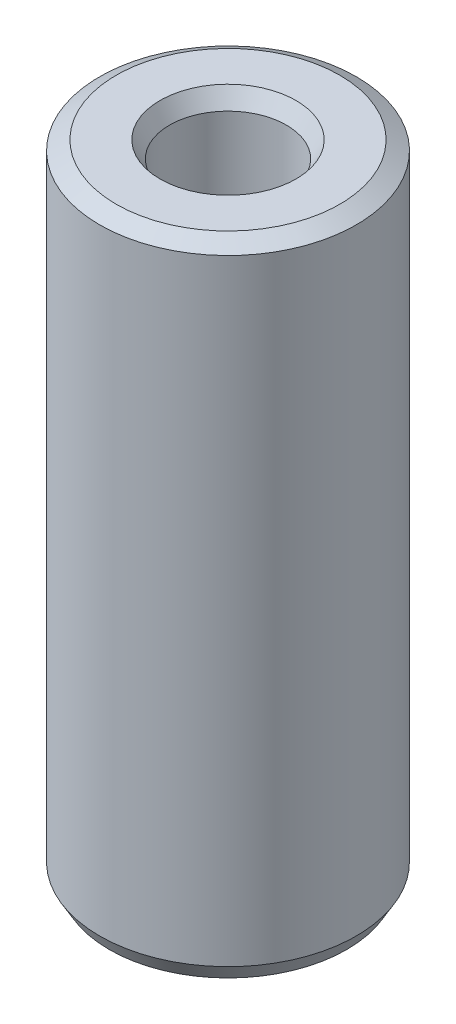
from build123d import *
from OCP.BRepFilletAPI import BRepFilletAPI_MakeChamfer

# Parameters (mm, degrees)
SKETCH1_R           = 30
BOSS_EXTRUDE1_DEPTH = 150.065307436
SKETCH2_R           = 13.669233363
CUT_EXTRUDE1_DEPTH  = 156.947415804
CHAMFER1_SIZE       = 2.232275058
CHAMFER1_SIZE2      = 3.866413817


with BuildPart() as part:
    # Sketch1 → Boss-Extrude1 (new body)
    with BuildSketch(Plane(origin=(0, 0, 0), x_dir=(1, 0, 0), z_dir=(0, 1, 0))):
        Circle(SKETCH1_R)
    extrude(amount=BOSS_EXTRUDE1_DEPTH)

    # Sketch2 → Cut-Extrude1 (cut, through all)
    with BuildSketch(Plane(origin=(0, 0, 0), x_dir=(1, 0, 0), z_dir=(0, 1, 0))):
        Circle(SKETCH2_R)
    extrude(amount=CUT_EXTRUDE1_DEPTH, mode=Mode.SUBTRACT)

    # Chamfer1: one chamfer whose edges measure the first distance from different faces: ONE call of the kernel's chamfer builder (chamfer() names one face for all edges)
    chamfer1_edges_1 = [part.edges().sort_by_distance(p)[0] for p in [
        (-13.669233363, 150.065307436, 0),
    ]]
    chamfer1_side_1 = [part.faces().sort_by_distance(p)[0] for p in [
        (-29.151471863, 150.065307436, 0),
    ]]
    chamfer1_edges_2 = [part.edges().sort_by_distance(p)[0] for p in [
        (-13.669233363, 0, 0),
    ]]
    chamfer1_side_2 = [part.faces().sort_by_distance(p)[0] for p in [
        (-13.669233363, 75.032653718, 0),
    ]]
    chamfer1_edges_3 = [part.edges().sort_by_distance(p)[0] for p in [
        (-30, 0, 0),
    ]]
    chamfer1_side_3 = [part.faces().sort_by_distance(p)[0] for p in [
        (-29.151471863, 0, 0),
    ]]
    chamfer1_edges_4 = [part.edges().sort_by_distance(p)[0] for p in [
        (-30, 150.065307436, 0),
    ]]
    chamfer1_side_4 = [part.faces().sort_by_distance(p)[0] for p in [
        (-30, 75.032653718, 0),
    ]]
    chamfer1 = BRepFilletAPI_MakeChamfer(part.part.solid().wrapped)
    for e in chamfer1_edges_1:
        chamfer1.Add(CHAMFER1_SIZE, CHAMFER1_SIZE2, e.wrapped, chamfer1_side_1[0].wrapped)  # the first distance lies on this face
    for e in chamfer1_edges_2:
        chamfer1.Add(CHAMFER1_SIZE, CHAMFER1_SIZE2, e.wrapped, chamfer1_side_2[0].wrapped)  # the first distance lies on this face
    for e in chamfer1_edges_3:
        chamfer1.Add(CHAMFER1_SIZE, CHAMFER1_SIZE2, e.wrapped, chamfer1_side_3[0].wrapped)  # the first distance lies on this face
    for e in chamfer1_edges_4:
        chamfer1.Add(CHAMFER1_SIZE, CHAMFER1_SIZE2, e.wrapped, chamfer1_side_4[0].wrapped)  # the first distance lies on this face
    add(Compound.cast(chamfer1.Shape()), mode=Mode.REPLACE)


solid = part.part
